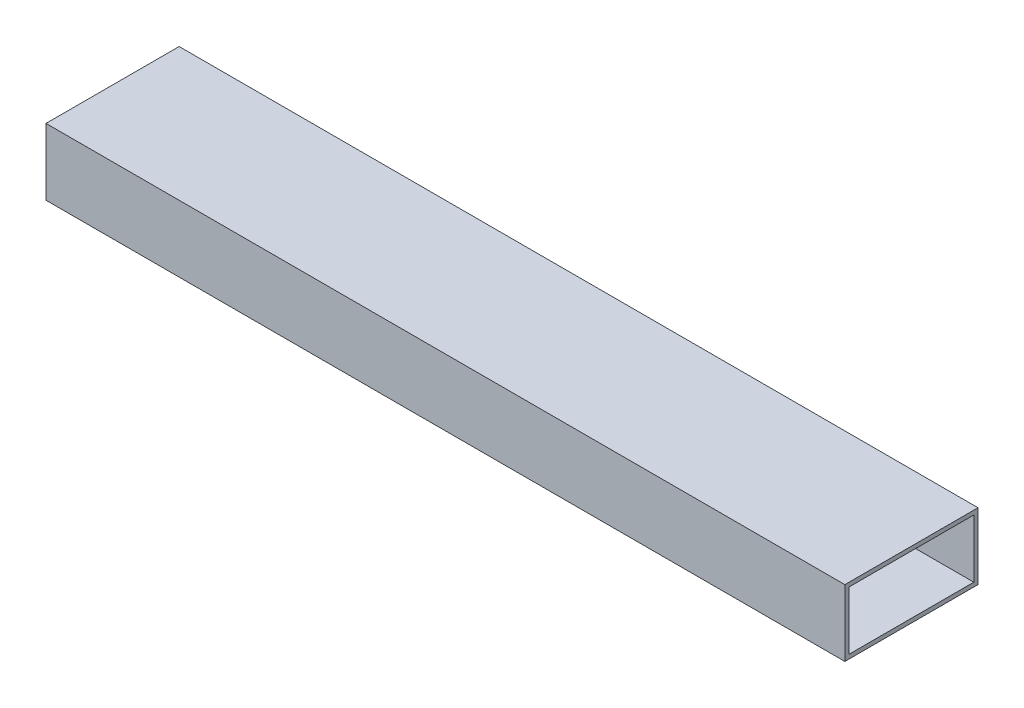
from build123d import *

# Parameters (mm, degrees)
SKETCH1_W           = 50.8
SKETCH1_H           = 25.4
SKETCH1_W_2         = 47.625
SKETCH1_H_2         = 22.225
EXTRUDE_THIN1_DEPTH = 304.8


with BuildPart() as part:
    # Sketch1 → Extrude-Thin1 (new body)
    with BuildSketch(Plane(origin=(0, 0, 0), x_dir=(0, 0, -1), z_dir=(1, 0, 0))):
        with Locations((25.4, 12.7)):
            Rectangle(SKETCH1_W, SKETCH1_H)
        with Locations((25.4, 12.7)):
            Rectangle(SKETCH1_W_2, SKETCH1_H_2, mode=Mode.SUBTRACT)
    extrude(amount=EXTRUDE_THIN1_DEPTH)


solid = part.part
